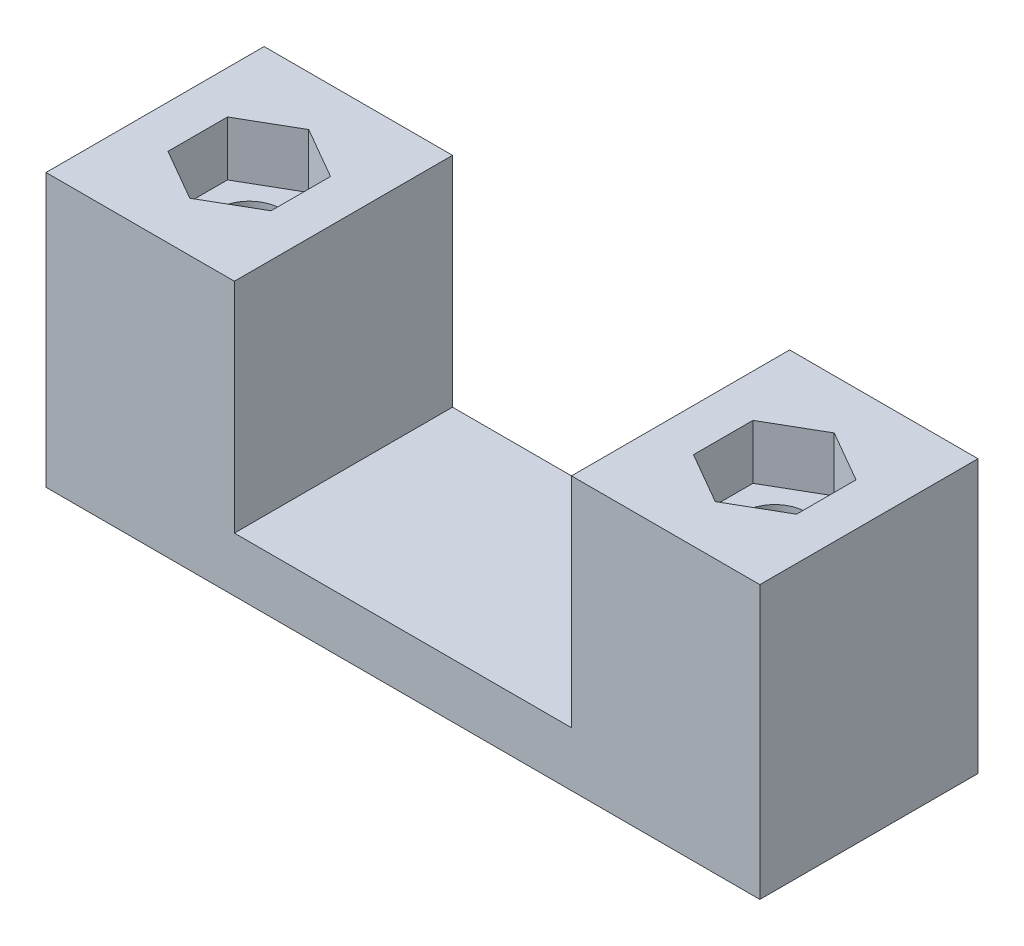
from build123d import *

# Parameters (mm, degrees)
SKETCH1_W           = 72
SKETCH1_H           = 22
BOSS_EXTRUDE1_DEPTH = 27.5
SKETCH2_W           = 34
SKETCH2_H           = 22
CUT_EXTRUDE1_DEPTH  = 22
SKETCH3_R           = 3.175
CUT_EXTRUDE2_DEPTH  = 69
CUT_EXTRUDE3_DEPTH  = 5.5


with BuildPart() as part:
    # Sketch1 → Boss-Extrude1 (new body)
    with BuildSketch(Plane(origin=(0, 0, 0), x_dir=(1, 0, 0), z_dir=(0, 1, 0))):
        with Locations((36, 11)):
            Rectangle(SKETCH1_W, SKETCH1_H)
    extrude(amount=BOSS_EXTRUDE1_DEPTH)

    # Sketch2 → Cut-Extrude1 (cut)
    with BuildSketch(Plane(origin=(0, 27.5, 0), x_dir=(1, 0, 0), z_dir=(0, 1, 0))):
        with Locations((36, 11)):
            Rectangle(SKETCH2_W, SKETCH2_H)
    extrude(amount=-CUT_EXTRUDE1_DEPTH, mode=Mode.SUBTRACT)

    # Sketch3 → Cut-Extrude2 (cut)
    with BuildSketch(Plane(origin=(0, 27.5, 0), x_dir=(1, 0, 0), z_dir=(0, 1, 0))):
        with Locations((9.5, 11)):
            Circle(SKETCH3_R)
        with Locations((62.5, 11)):
            Circle(SKETCH3_R)
    extrude(amount=-CUT_EXTRUDE2_DEPTH, mode=Mode.SUBTRACT)

    # Sketch4 → Cut-Extrude3 (cut)
    with BuildSketch(Plane(origin=(0, 27.5, 0), x_dir=(1, 0, 0), z_dir=(0, 1, 0))):
        Polygon((9.5, 17), (4.303847577, 14), (4.303847577, 8), (9.5, 5), (14.696152423, 8), (14.696152423, 14), align=None)
        Polygon((57.303847577, 14), (62.5, 17), (67.696152423, 14), (67.696152423, 8), (62.5, 5), (57.303847577, 8), align=None)
    extrude(amount=-CUT_EXTRUDE3_DEPTH, mode=Mode.SUBTRACT)


solid = part.part
